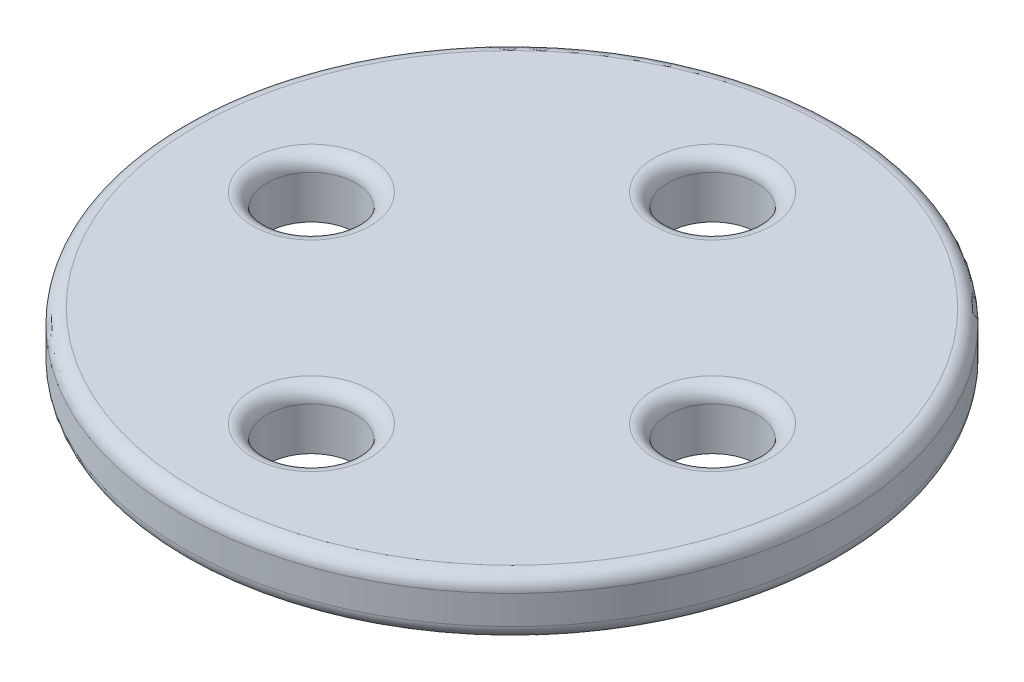
from build123d import *

# Parameters (mm, degrees)
SKETCH1_R                      = 11.5
SKETCH1_R_2                    = 1.55
BOSS_EXTRUDE1_DEPTH            = 2
FILLET1_R                      = 0.5
GL_F_SIDE_BLUE_RAISED_START    = -0.6
GL_F_SIDE_BLUE_RAISED_DEPTH    = 0.6
GL_F_SIDE_WHITE_RAISED_START   = -0.6
GL_F_SIDE_WHITE_RAISED_DEPTH   = 0.6
GL_F_SIDE_WHITE_RAISED_2_DEPTH = 0.6
GL_F_SIDE_WHITE_RAISED_3_DEPTH = 0.6
GL_F_SIDE_WHITE_RAISED_4_DEPTH = 0.6
GL_F_SIDE_WHITE_RAISED_5_DEPTH = 0.6


with BuildPart() as part:
    # Sketch1 → Boss-Extrude1 (new body)
    with BuildSketch(Plane(origin=(0, 0, 0), x_dir=(1, 0, 0), z_dir=(0, 1, 0))):
        Circle(SKETCH1_R)
        with Locations((0, 7)):
            Circle(SKETCH1_R_2, mode=Mode.SUBTRACT)
        with Locations((7, 0)):
            Circle(SKETCH1_R_2, mode=Mode.SUBTRACT)
        with Locations((0, -7)):
            Circle(SKETCH1_R_2, mode=Mode.SUBTRACT)
        with Locations((-7, 0)):
            Circle(SKETCH1_R_2, mode=Mode.SUBTRACT)
    extrude(amount=BOSS_EXTRUDE1_DEPTH)

    # Fillet1
    fillet1_edges = [part.edges().sort_by_distance(p)[0] for p in [
        (-8.55, 2, 0),
        (5.45, 2, 0),
        (-11.5, 2, 0),
        (-1.55, 2, -7),
        (-1.55, 2, 7),
        (-11.5, 0, 0),
    ]]
    fillet(fillet1_edges, radius=FILLET1_R)


with BuildPart() as body_2:
    # GL_F_side_blue → GL_F_side_blue_raised (new body)
    with BuildSketch(Plane(origin=(0, 0, 0), x_dir=(1, 0, 0), z_dir=(0, 1, 0)).offset(GL_F_SIDE_BLUE_RAISED_START)):
        Polygon((4.101219331, -5.791204538), (3.542604974, -5.232590181), (4.037579721, -4.737615434), (3.74766594, -4.447701654), (3.252691193, -4.9426764), (2.694076836, -4.384062043), (3.189051583, -3.889087297), (1.209152596, -1.909188309), (1.323340905, -1.795), (-1.795, -1.795), (-1.795, 1.323340905), (-1.909188309, 1.209152596), (-4.851953883, 4.151918169), (-4.716054022, 4.179390353), (-4.570146913, 4.239827057), (-4.380487824, 4.380487824), (-4.239827057, 4.570146913), (-4.179390353, 4.716054022), (-4.151918169, 4.851953883), (-1.209152596, 1.909188309), (-1.323340905, 1.795), (1.323340905, 1.795), (1.209152596, 1.909188309), (5.663722497, 6.363758211), (5.687194875, 6.257134584), (5.751365912, 6.102211995), (5.900767403, 5.900767403), (6.102211995, 5.751365912), (6.257134584, 5.687194875), (6.363758211, 5.663722497), (1.909188309, 1.209152596), (1.795, 1.323340905), (1.795, -1.323340905), (1.909188309, -1.209152596), (3.889087297, -3.189051583), (4.384062043, -2.694076836), (4.9426764, -3.252691193), (4.447701654, -3.74766594), (4.737615434, -4.037579721), (5.232590181, -3.542604974), (5.791204538, -4.101219331), (5.296229791, -4.596194078), (6.993286066, -6.293250353), (6.293250353, -6.993286066), (4.596194078, -5.296229791), align=None)
        Polygon((-0.296176538, 0.794126253), (-0.296176538, 0.902930022), (-0.3174031, 1.009643156), (-0.3590405, 1.110164731), (-0.419488634, 1.200631758), (-0.496424517, 1.27756764), (-0.586891544, 1.338015775), (-0.687413119, 1.379653175), (-0.794126253, 1.400879737), (-0.902930022, 1.400879737), (-1.009643156, 1.379653175), (-1.110164731, 1.338015775), (-1.200631758, 1.27756764), (-1.27756764, 1.200631758), (-1.338015775, 1.110164731), (-1.379653175, 1.009643156), (-1.400879737, 0.902930022), (-1.400879737, 0.794126253), (-1.379653175, 0.687413119), (-1.338015775, 0.586891544), (-1.27756764, 0.496424517), (-1.200631758, 0.419488634), (-1.110164731, 0.3590405), (-1.009643156, 0.3174031), (-0.902930022, 0.296176538), (-0.794126253, 0.296176538), (-0.687413119, 0.3174031), (-0.586891544, 0.3590405), (-0.496424517, 0.419488634), (-0.419488634, 0.496424517), (-0.3590405, 0.586891544), (-0.3174031, 0.687413119), align=None, mode=Mode.SUBTRACT)
    extrude(amount=GL_F_SIDE_BLUE_RAISED_DEPTH)


with BuildPart() as body_3:
    # GL_F_side_white → GL_F_side_white_raised (new body)
    with BuildSketch(Plane(origin=(0, 0, 0), x_dir=(1, 0, 0), z_dir=(0, 1, 0)).offset(GL_F_SIDE_WHITE_RAISED_START)):
        Polygon((-5.627987495, -6.383890654), (-5.695762229, -6.466474407), (-5.778345982, -6.534249141), (-5.872565106, -6.584610312), (-5.974798812, -6.615622568), (-6.081118318, -6.626094125), (-6.187437824, -6.615622568), (-6.289671531, -6.584610312), (-6.383890654, -6.534249141), (-6.466474407, -6.466474407), (-6.534249141, -6.383890654), (-6.584610312, -6.289671531), (-6.615622568, -6.187437824), (-6.626094125, -6.081118318), (-6.615622568, -5.974798812), (-6.584610312, -5.872565106), (-6.534249141, -5.778345982), (-6.466474407, -5.695762229), (-6.383890654, -5.627987495), (-6.289671531, -5.577626324), (-6.187437824, -5.546614068), (-6.081118318, -5.536142511), (-5.974798812, -5.546614068), (-5.872565106, -5.577626324), (-5.778345982, -5.627987495), (-5.695762229, -5.695762229), (-5.627987495, -5.778345982), (-5.577626324, -5.872565106), (-5.546614068, -5.974798812), (-5.536142511, -6.081118318), (-5.546614068, -6.187437824), (-5.577626324, -6.289671531), align=None)
    extrude(amount=GL_F_SIDE_WHITE_RAISED_DEPTH)


with BuildPart() as body_4:
    # GL_F_side_white → GL_F_side_white_raised 2 (new body)
    with BuildSketch(Plane(origin=(0, 0, 0), x_dir=(1, 0, 0), z_dir=(0, 1, 0)).offset(GL_F_SIDE_WHITE_RAISED_START)):
        Polygon((-3.789509864, -4.545413023), (-3.857284598, -4.627996776), (-3.939868351, -4.69577151), (-4.034087475, -4.746132681), (-4.136321181, -4.777144937), (-4.242640687, -4.787616494), (-4.348960193, -4.777144937), (-4.4511939, -4.746132681), (-4.545413023, -4.69577151), (-4.627996776, -4.627996776), (-4.69577151, -4.545413023), (-4.746132681, -4.4511939), (-4.777144937, -4.348960193), (-4.787616494, -4.242640687), (-4.777144937, -4.136321181), (-4.746132681, -4.034087475), (-4.69577151, -3.939868351), (-4.627996776, -3.857284598), (-4.545413023, -3.789509864), (-4.4511939, -3.739148693), (-4.348960193, -3.708136437), (-4.242640687, -3.69766488), (-4.136321181, -3.708136437), (-4.034087475, -3.739148693), (-3.939868351, -3.789509864), (-3.857284598, -3.857284598), (-3.789509864, -3.939868351), (-3.739148693, -4.034087475), (-3.708136437, -4.136321181), (-3.69766488, -4.242640687), (-3.708136437, -4.348960193), (-3.739148693, -4.4511939), align=None)
    extrude(amount=GL_F_SIDE_WHITE_RAISED_2_DEPTH)


with BuildPart() as body_5:
    # GL_F_side_white → GL_F_side_white_raised 3 (new body)
    with BuildSketch(Plane(origin=(0, 0, 0), x_dir=(1, 0, 0), z_dir=(0, 1, 0)).offset(GL_F_SIDE_WHITE_RAISED_START)):
        Polygon((-0.395397314, 0.545755801), (-0.463172049, 0.463172049), (-0.545755801, 0.395397314), (-0.639974925, 0.345036143), (-0.742208632, 0.314023888), (-0.848528137, 0.30355233), (-0.954847643, 0.314023888), (-1.05708135, 0.345036143), (-1.151300474, 0.395397314), (-1.233884226, 0.463172049), (-1.30165896, 0.545755801), (-1.352020131, 0.639974925), (-1.383032387, 0.742208632), (-1.393503945, 0.848528137), (-1.383032387, 0.954847643), (-1.352020131, 1.05708135), (-1.30165896, 1.151300474), (-1.233884226, 1.233884226), (-1.151300474, 1.30165896), (-1.05708135, 1.352020131), (-0.954847643, 1.383032387), (-0.848528137, 1.393503945), (-0.742208632, 1.383032387), (-0.639974925, 1.352020131), (-0.545755801, 1.30165896), (-0.463172049, 1.233884226), (-0.395397314, 1.151300474), (-0.345036143, 1.05708135), (-0.314023888, 0.954847643), (-0.30355233, 0.848528137), (-0.314023888, 0.742208632), (-0.345036143, 0.639974925), align=None)
    extrude(amount=GL_F_SIDE_WHITE_RAISED_3_DEPTH)


with BuildPart() as body_6:
    # GL_F_side_white → GL_F_side_white_raised 4 (new body)
    with BuildSketch(Plane(origin=(0, 0, 0), x_dir=(1, 0, 0), z_dir=(0, 1, 0)).offset(GL_F_SIDE_WHITE_RAISED_START)):
        Polygon((-4.387614684, 4.387614684), (-4.508082574, 4.288749242), (-4.645523398, 4.215285591), (-4.794655382, 4.170046898), (-4.949747468, 4.154771661), (-5.104839555, 4.170046898), (-5.253971539, 4.215285591), (-5.391412363, 4.288749242), (-5.511880252, 4.387614684), (-5.610745694, 4.508082574), (-5.684209345, 4.645523398), (-5.729448038, 4.794655382), (-5.744723275, 4.949747468), (-5.729448038, 5.104839555), (-5.684209345, 5.253971539), (-5.610745694, 5.391412363), (-5.511880252, 5.511880252), (-5.391412363, 5.610745694), (-5.253971539, 5.684209345), (-5.104839555, 5.729448038), (-4.949747468, 5.744723275), (-4.794655382, 5.729448038), (-4.645523398, 5.684209345), (-4.508082574, 5.610745694), (-4.387614684, 5.511880252), (-4.288749242, 5.391412363), (-4.215285591, 5.253971539), (-4.170046898, 5.104839555), (-4.154771661, 4.949747468), (-4.170046898, 4.794655382), (-4.215285591, 4.645523398), (-4.288749242, 4.508082574), align=None)
    extrude(amount=GL_F_SIDE_WHITE_RAISED_4_DEPTH)


with BuildPart() as body_7:
    # GL_F_side_white → GL_F_side_white_raised 5 (new body)
    with BuildSketch(Plane(origin=(0, 0, 0), x_dir=(1, 0, 0), z_dir=(0, 1, 0)).offset(GL_F_SIDE_WHITE_RAISED_START)):
        Polygon((7.10287051, 5.907894264), (6.974825793, 5.80281068), (6.828740629, 5.724726533), (6.670228989, 5.676642553), (6.505382387, 5.66040658), (6.340535785, 5.676642553), (6.182024145, 5.724726533), (6.035938981, 5.80281068), (5.907894264, 5.907894264), (5.80281068, 6.035938981), (5.724726533, 6.182024145), (5.676642553, 6.340535785), (5.66040658, 6.505382387), (5.676642553, 6.670228989), (5.724726533, 6.828740629), (5.80281068, 6.974825793), (5.907894264, 7.10287051), (6.035938981, 7.207954094), (6.182024145, 7.286038241), (6.340535785, 7.334122221), (6.505382387, 7.350358194), (6.670228989, 7.334122221), (6.828740629, 7.286038241), (6.974825793, 7.207954094), (7.10287051, 7.10287051), (7.207954094, 6.974825793), (7.286038241, 6.828740629), (7.334122221, 6.670228989), (7.350358194, 6.505382387), (7.334122221, 6.340535785), (7.286038241, 6.182024145), (7.207954094, 6.035938981), align=None)
    extrude(amount=GL_F_SIDE_WHITE_RAISED_5_DEPTH)


solid = Compound([part.part, body_2.part, body_3.part, body_4.part, body_5.part, body_6.part, body_7.part])
